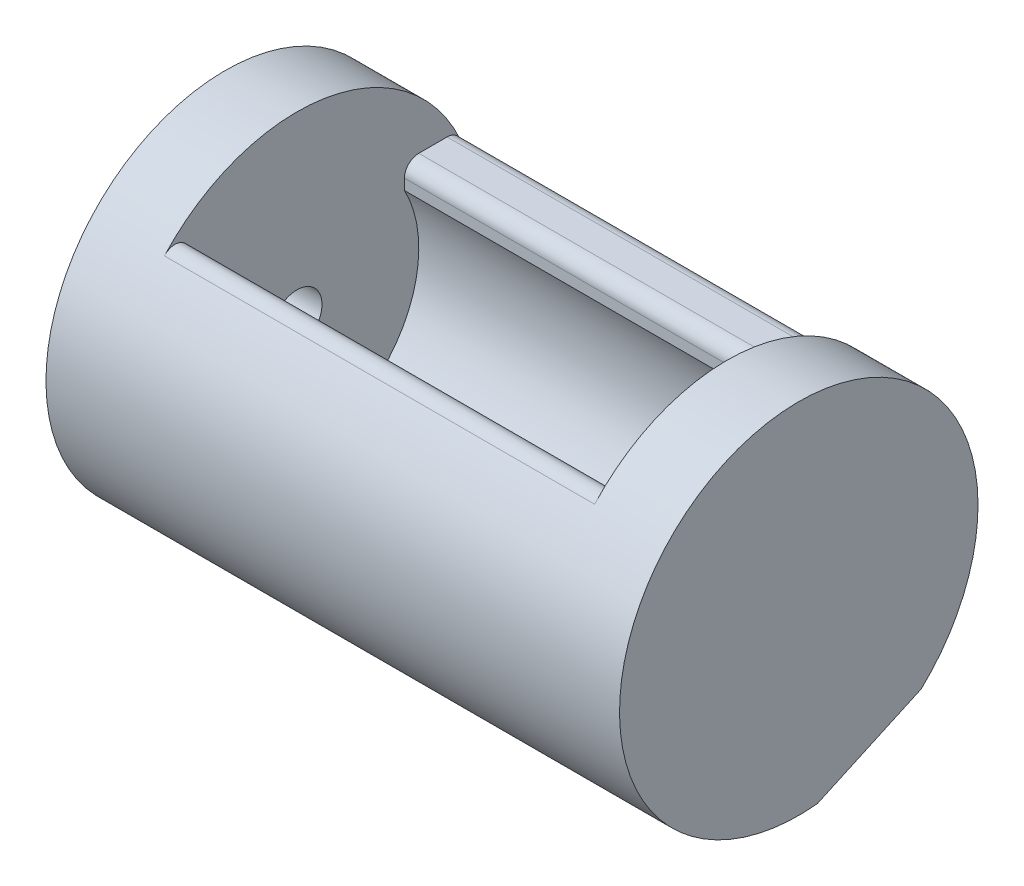
from build123d import *

# Parameters (mm, degrees)
SKETCH2_R               = 25
BOSS_EXTRUDE1_DEPTH     = 80
CUT_EXTRUDE3_DEPTH      = 30
CUT_EXTRUDE4_DEPTH      = 40
CUT_EXTRUDE4_DEPTH_BACK = 20
SKETCH5_R               = 17
FILLET3_R               = 2
SKETCH6_R               = 3.5
CUT_EXTRUDE5_DEPTH      = 20
CUT_EXTRUDE7_DEPTH      = 3
SKETCH9_W               = 60
SKETCH9_H               = 6
CUT_EXTRUDE9_DEPTH      = 30
FILLET5_R               = 2
CUT_EXTRUDE10_DEPTH     = 88.464278423
BOSS_EXTRUDE2_DEPTH     = 2.5


with BuildPart() as part:
    # Sketch2 → Boss-Extrude1 (new body)
    with BuildSketch(Plane(origin=(0, 0, 0), x_dir=(0, 0, -1), z_dir=(1, 0, 0))):
        Circle(SKETCH2_R)
    extrude(amount=BOSS_EXTRUDE1_DEPTH)

    # Sketch4 → Cut-Extrude3 (cut)
    with BuildSketch(Plane(origin=(0, 0, 0), x_dir=(1, 0, 0), z_dir=(0, 1, 0))):
        Polygon((10, 0), (10, 15), (70, 15), (70, -15), (10, -15), align=None)
    extrude(amount=CUT_EXTRUDE3_DEPTH, mode=Mode.SUBTRACT)

    # Sketch5 → Cut-Extrude4 (cut, two sides: drawn at the far end of the back side and taken through both)
    with BuildSketch(Plane(origin=(30, 0, 0), x_dir=(0, 0, -1), z_dir=(1, 0, 0)).offset(-CUT_EXTRUDE4_DEPTH_BACK)):
        Circle(SKETCH5_R)
    extrude(amount=CUT_EXTRUDE4_DEPTH + CUT_EXTRUDE4_DEPTH_BACK, mode=Mode.SUBTRACT)

    # Fillet3
    fillet3_edges = [part.edges().sort_by_distance(p)[0] for p in [
        (40, 20, 15),
        (40, 20, -15),
    ]]
    fillet(fillet3_edges, radius=FILLET3_R)

    # Sketch6 → Cut-Extrude5 (cut)
    with BuildSketch(Plane(origin=(0, 0, 0), x_dir=(0, 0, -1), z_dir=(1, 0, 0))):
        Circle(SKETCH6_R)
    extrude(amount=CUT_EXTRUDE5_DEPTH, mode=Mode.SUBTRACT)

    # Sketch7 → Cut-Extrude7 (cut)
    with BuildSketch(Plane(origin=(0, 0, 0), x_dir=(0, 0, -1), z_dir=(1, 0, 0))):
        with BuildLine():
            Line((-8.5, -0.449954403), (-8.5, 0))
            ThreePointArc((-8.5, 0), (0, 8.5), (8.5, 0))
            Line((8.5, 0), (8.5, -17.5))
            Line((8.5, -17.5), (-8.5, -17.5))
            Line((-8.5, -17.5), (-8.5, -0.449954403))
        make_face()
    extrude(amount=CUT_EXTRUDE7_DEPTH, mode=Mode.SUBTRACT)

    # Sketch9 → Cut-Extrude9 (cut)
    with BuildSketch(Plane.XY):
        with Locations((40, 14.491933385)):
            Rectangle(SKETCH9_W, SKETCH9_H)
    extrude(amount=-CUT_EXTRUDE9_DEPTH, mode=Mode.SUBTRACT)

    # Fillet5
    fillet5_edges = [part.edges().sort_by_distance(p)[0] for p in [
        (40, 11.491933385, -15),
        (40, 11.491933385, -22.202150055),
    ]]
    fillet(fillet5_edges, radius=FILLET5_R)

    # Sketch10 → Cut-Extrude10 (cut, through all)
    with BuildSketch(Plane(origin=(0, 0, 0), x_dir=(0, 0, -1), z_dir=(1, 0, 0))):
        Polygon((2.596359956, -24.864812788), (17.08173113, -18.254162857), (17.807765235, -19.845061424), (3.322394062, -26.455711355), align=None)
    extrude(amount=CUT_EXTRUDE10_DEPTH, mode=Mode.SUBTRACT)

    # Sketch11 → Boss-Extrude2 (add)
    with BuildSketch(Plane(origin=(0, 0, 0), x_dir=(0, 0, -1), z_dir=(1, 0, 0))):
        Polygon((8.5, -17.5), (-8.5, -17.5), (-8.5, -18.75), (9.75, -18.75), (9.75, 0), (8.5, 0), align=None)
    extrude(amount=-BOSS_EXTRUDE2_DEPTH)


solid = part.part
